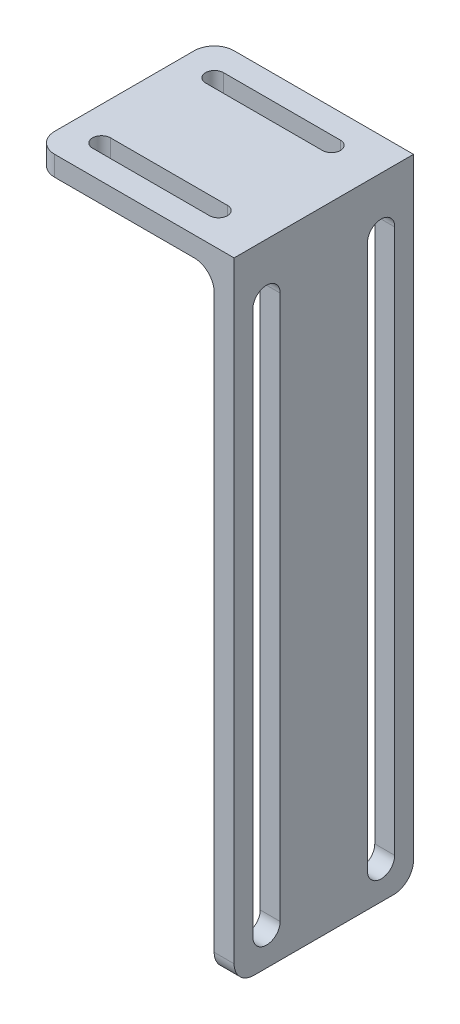
from build123d import *

# Parameters (mm, degrees)
BOSS_EXTRUDE1_DEPTH = 27
CUT_EXTRUDE1_DEPTH  = 104.218215447
CUT_EXTRUDE2_DEPTH  = 103.386522551
FILLET1_R           = 3
FILLET2_R           = 3


with BuildPart() as part:
    # Sketch1 → Boss-Extrude1 (new body)
    with BuildSketch(Plane.XY):
        Polygon((0, 0), (3, 0), (3, 95), (-27, 95), (-27, 92), (0, 92), align=None)
    extrude(amount=BOSS_EXTRUDE1_DEPTH)

    # Sketch6 → Cut-Extrude1 (cut, through all)
    with BuildSketch(Plane(origin=(3, 0, 0), x_dir=(0, 0, -1), z_dir=(1, 0, 0))):
        with BuildLine():
            Line((-20.07, 86.95), (-20.07, 5.05))
            ThreePointArc((-20.07, 5.05), (-22.12, 3), (-24.17, 5.05))
            Line((-24.17, 5.05), (-24.17, 86.95))
            ThreePointArc((-24.17, 86.95), (-22.12, 89), (-20.07, 86.95))
        make_face()
        with BuildLine():
            Line((-2.83, 86.95), (-2.83, 5.05))
            ThreePointArc((-2.83, 5.05), (-4.88, 3), (-6.93, 5.05))
            Line((-6.93, 5.05), (-6.93, 86.95))
            ThreePointArc((-6.93, 86.95), (-4.88, 89), (-2.83, 86.95))
        make_face()
    extrude(amount=-CUT_EXTRUDE1_DEPTH, mode=Mode.SUBTRACT)

    # Sketch7 → Cut-Extrude2 (cut, through all)
    with BuildSketch(Plane(origin=(0, 95, 0), x_dir=(1, 0, 0), z_dir=(0, 1, 0))):
        with BuildLine():
            Line((-21.95, -3.65), (-4.35, -3.65))
            ThreePointArc((-4.35, -3.65), (-3, -5), (-4.35, -6.35))
            Line((-4.35, -6.35), (-21.95, -6.35))
            ThreePointArc((-21.95, -6.35), (-23.3, -5), (-21.95, -3.65))
        make_face()
        with BuildLine():
            Line((-21.95, -20.65), (-4.35, -20.65))
            ThreePointArc((-4.35, -20.65), (-3, -22), (-4.35, -23.35))
            Line((-4.35, -23.35), (-21.95, -23.35))
            ThreePointArc((-21.95, -23.35), (-23.3, -22), (-21.95, -20.65))
        make_face()
    extrude(amount=-CUT_EXTRUDE2_DEPTH, mode=Mode.SUBTRACT)

    # Fillet1
    fillet1_edges = [part.edges().sort_by_distance(p)[0] for p in [
        (0, 92, 13.5),
    ]]
    fillet(fillet1_edges, radius=FILLET1_R - 0.0001)  # a hair under: the kernel refuses the full size

    # Fillet2
    fillet2_edges = [part.edges().sort_by_distance(p)[0] for p in [
        (-27, 93.5, 27),
        (-27, 93.5, 0),
        (1.5, 0, 0),
        (1.5, 0, 27),
    ]]
    fillet(fillet2_edges, radius=FILLET2_R)


solid = part.part
